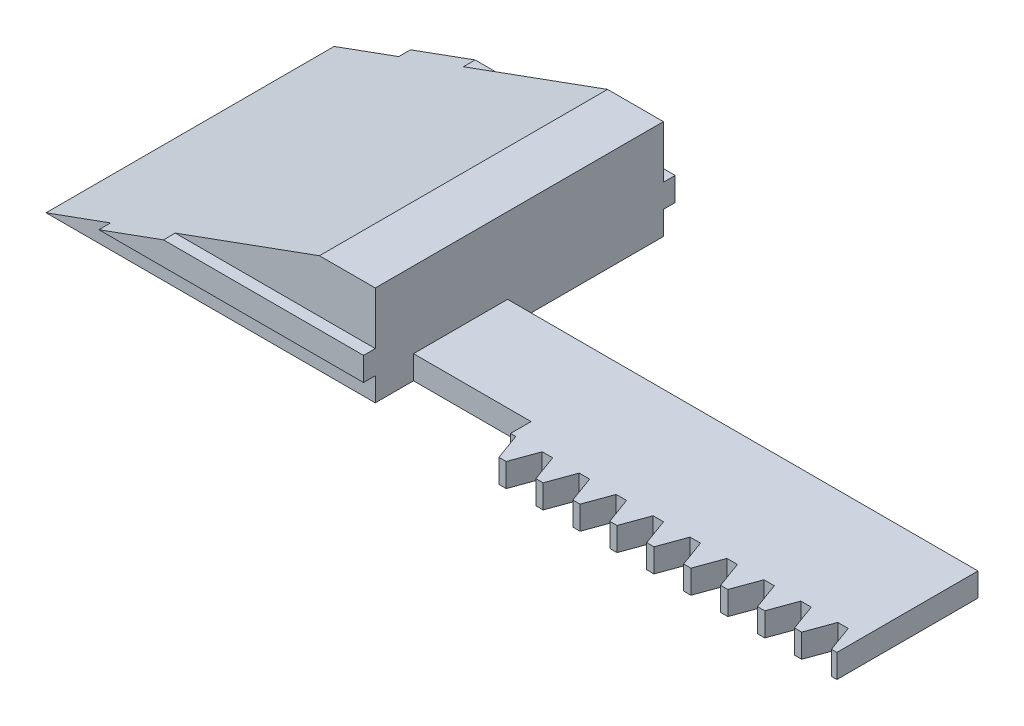
from build123d import *

# Parameters (mm, degrees)
COMBINE1_START     = 34.612659565
COMBINE1_DEPTH     = 2
COMBINE1_START_2   = 37.615879947
COMBINE1_2_DEPTH   = 25.5
COMBINE1_START_3   = 36.615879947
COMBINE1_3_DEPTH   = 27.5
CUT_EXTRUDE1_DEPTH = 0.5
CUT_EXTRUDE2_DEPTH = 0.5
CUT_EXTRUDE3_DEPTH = 0.5
CUT_EXTRUDE5_DEPTH = 0.5
SKETCH9_W          = 5
SKETCH9_H          = 24.5
CUT_EXTRUDE6_DEPTH = 1
SKETCH10_W         = 40
SKETCH10_H         = 2
CUT_EXTRUDE7_DEPTH = 1


with BuildPart() as part:
    # Combine1: read off the stored shape, not the designer's step
    # Combine1 outline → Combine1 (new body)
    with BuildSketch(Plane(origin=(0, 0, 0), x_dir=(1, 0, 0), z_dir=(0, 1, 0)).offset(COMBINE1_START)):
        Polygon((17.883282848, -59.365879947), (27.883282848, -59.365879947), (27.883282848, -61.115879947), (28.327718217, -61.115879947), (29.146651244, -63.365879947), (29.761507101, -63.365879947), (30.580440128, -61.115879947), (31.469310867, -61.115879947), (32.288243894, -63.365879947), (32.903099751, -63.365879947), (33.722032778, -61.115879947), (34.610903517, -61.115879947), (35.429836544, -63.365879947), (36.044692401, -63.365879947), (36.863625428, -61.115879947), (37.752496167, -61.115879947), (38.571429194, -63.365879947), (39.186285051, -63.365879947), (40.005218078, -61.115879947), (40.894088817, -61.115879947), (41.713021844, -63.365879947), (42.327877701, -63.365879947), (43.146810728, -61.115879947), (44.035681467, -61.115879947), (44.854614494, -63.365879947), (45.469470351, -63.365879947), (46.288403378, -61.115879947), (47.177274117, -61.115879947), (47.996207144, -63.365879947), (48.611063001, -63.365879947), (49.429996028, -61.115879947), (50.318866767, -61.115879947), (51.137799794, -63.365879947), (51.752655651, -63.365879947), (52.571588678, -61.115879947), (53.460459417, -61.115879947), (54.279392444, -63.365879947), (54.894248301, -63.365879947), (55.713181328, -61.115879947), (56.602052067, -61.115879947), (57.420985094, -63.365879947), (57.883282848, -63.365879947), (57.883282848, -50.365879947), (17.883282848, -50.365879947), align=None)
    extrude(amount=COMBINE1_DEPTH)

    # Combine1 2 outline → Combine1 2 (add)
    with BuildSketch(Plane.XY.offset(COMBINE1_START_2)):
        Polygon((17.883282848, 44.075659565), (15.882661668, 44.075659565), (-10.116717152, 34.612659565), (17.883282848, 34.612659565), align=None)
    extrude(amount=COMBINE1_2_DEPTH)

    # Combine1 3 outline → Combine1 3 (add)
    with BuildSketch(Plane.XY.offset(COMBINE1_START_3)):
        Polygon((17.883282848, 38.612659565), (0.873192525, 38.612659565), (-4.621762313, 36.612659565), (17.883282848, 36.612659565), align=None)
    extrude(amount=COMBINE1_3_DEPTH)

    # Sketch2 → Cut-Extrude1 (cut)
    with BuildSketch(Plane.XY.offset(63.115879947)):
        Polygon((0.873192525, 38.612659565), (15.882661668, 44.075659565), (17.883282848, 44.075659565), (17.883282848, 38.612659565), align=None)
        Polygon((17.883282848, 36.612659565), (17.883282848, 34.612659565), (-10.116717152, 34.612659565), (-4.621762313, 36.612659565), align=None)
    extrude(amount=-CUT_EXTRUDE1_DEPTH, mode=Mode.SUBTRACT)

    # Sketch3 → Cut-Extrude2 (cut)
    with BuildSketch(Plane.XY.offset(64.115879947)):
        Polygon((17.883282848, 36.612659565), (17.883282848, 38.612659565), (0.873192525, 38.612659565), (-4.621762313, 36.612659565), align=None)
    extrude(amount=-CUT_EXTRUDE2_DEPTH, mode=Mode.SUBTRACT)

    # Sketch4 → Cut-Extrude3 (cut)
    with BuildSketch(Plane(origin=(0, 0, 37.615879947), x_dir=(-1, 0, 0), z_dir=(0, 0, -1))):
        Polygon((-17.883282848, 38.612659565), (-17.883282848, 44.075659565), (-15.882661668, 44.075659565), (-0.873192525, 38.612659565), align=None)
        Polygon((-17.883282848, 36.612659565), (4.621762313, 36.612659565), (10.116717152, 34.612659565), (-17.883282848, 34.612659565), align=None)
    extrude(amount=-CUT_EXTRUDE3_DEPTH, mode=Mode.SUBTRACT)

    # Sketch7 → Cut-Extrude5 (cut)
    with BuildSketch(Plane(origin=(0, 0, 36.615879947), x_dir=(-1, 0, 0), z_dir=(0, 0, -1))):
        Polygon((-17.883282848, 38.612659565), (-17.883282848, 36.612659565), (4.621762313, 36.612659565), (-0.873192525, 38.612659565), align=None)
    extrude(amount=-CUT_EXTRUDE5_DEPTH, mode=Mode.SUBTRACT)

    # Sketch9 → Cut-Extrude6 (cut)
    with BuildSketch(Plane(origin=(0, 44.075659565, 0), x_dir=(1, 0, 0), z_dir=(0, 1, 0))):
        with Locations((15.383282848, -50.365879947)):
            Rectangle(SKETCH9_W, SKETCH9_H)
    extrude(amount=-CUT_EXTRUDE6_DEPTH, mode=Mode.SUBTRACT)

    # Sketch10 → Cut-Extrude7 (cut)
    with BuildSketch(Plane(origin=(0, 0, 50.365879947), x_dir=(-1, 0, 0), z_dir=(0, 0, -1))):
        with Locations((-37.883282848, 35.612659565)):
            Rectangle(SKETCH10_W, SKETCH10_H)
    extrude(amount=-CUT_EXTRUDE7_DEPTH, mode=Mode.SUBTRACT)


solid = part.part
